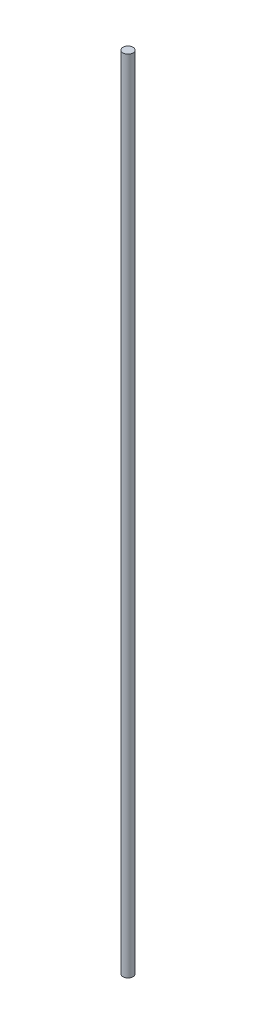
from build123d import *

# Parameters (mm, degrees)
SKETCH_1_R      = 0.5
EXTRUDE_1_DEPTH = 80


with BuildPart() as part:
    # 草图1 → 凸台-拉伸1 (new body)
    with BuildSketch(Plane(origin=(0, 0, 0), x_dir=(1, 0, 0), z_dir=(0, 1, 0))):
        Circle(SKETCH_1_R)
    extrude(amount=EXTRUDE_1_DEPTH)


solid = part.part
